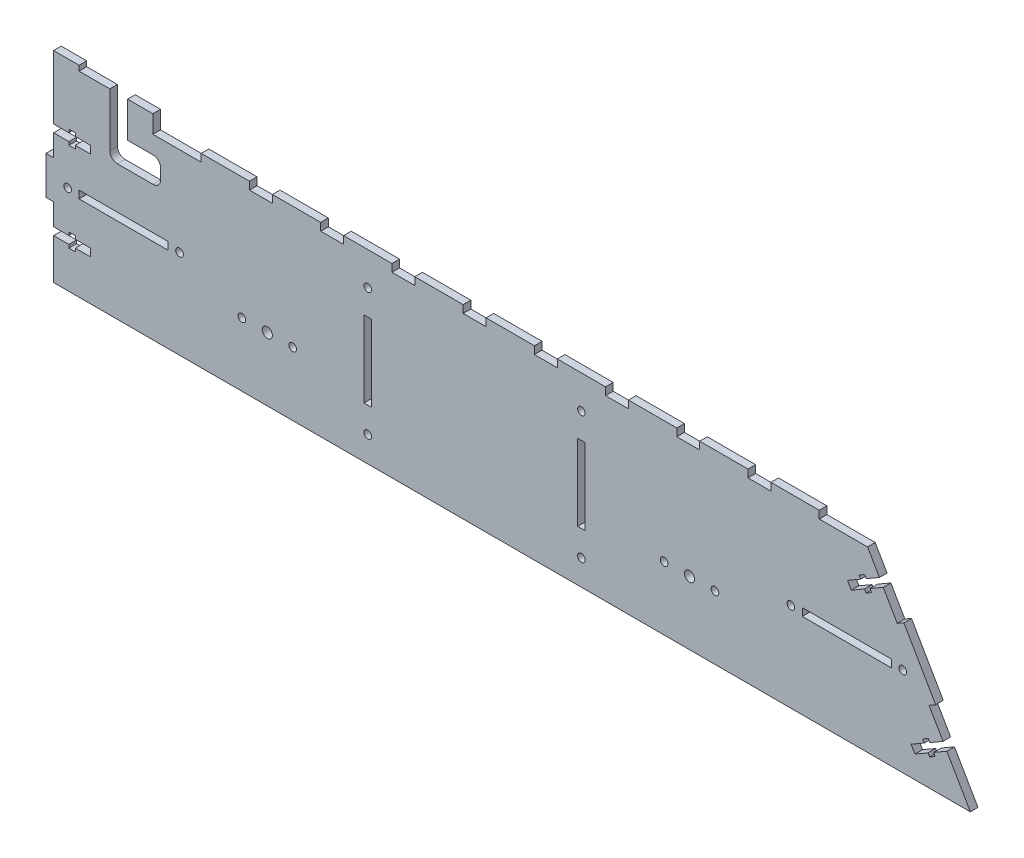
from build123d import *

# Parameters (mm, degrees)
SKETCH_1_R             = 2
SKETCH_1_R_2           = 1.5
EXTRUDE_1_DEPTH        = 3
SKETCH_2_W             = 19
SKETCH_2_H             = 3
EXTRUDE_2_DEPTH        = 3
PATTERN_LINEAR_1_COUNT = 9
PATTERN_LINEAR_1_PITCH = 28
SKETCH_3_W             = 3
SKETCH_3_H             = 30
CUT_EXTRUDE_1_DEPTH    = 3
SKETCH_4_W             = 35
SKETCH_4_H             = 3
CUT_EXTRUDE_2_DEPTH    = 3
SKETCH_5_R             = 1.5
CUT_EXTRUDE_3_DEPTH    = 3
CUT_EXTRUDE_4_DEPTH    = 3
CUT_EXTRUDE_5_DEPTH    = 3
SKETCH_8_W             = 39
SKETCH_8_H             = 3
EXTRUDE_3_DEPTH        = 9
SKETCH_9_W             = 29
SKETCH_9_H             = 3
CUT_EXTRUDE_6_DEPTH    = 2
SKETCH_11_W            = 3
SKETCH_11_H            = 25
EXTRUDE_5_DEPTH        = 3
SKETCH_12_W            = 3
SKETCH_12_H            = 15
EXTRUDE_6_DEPTH        = 3
CUT_EXTRUDE_7_DEPTH    = 3
FILLET_1_R             = 3


with BuildPart() as part:
    # Эскиз1 → Бобышка-Вытянуть1 (new body)
    with BuildSketch(Plane.XY):
        Polygon((320, 70), (360.414518843, 0), (0, 0), (0, 70), align=None)
        with Locations((84, 25)):
            Circle(SKETCH_1_R, mode=Mode.SUBTRACT)
        with Locations((250, 25)):
            Circle(SKETCH_1_R, mode=Mode.SUBTRACT)
        with Locations((94, 25)):
            Circle(SKETCH_1_R_2, mode=Mode.SUBTRACT)
        with Locations((74, 25)):
            Circle(SKETCH_1_R_2, mode=Mode.SUBTRACT)
        with Locations((240, 25)):
            Circle(SKETCH_1_R_2, mode=Mode.SUBTRACT)
        with Locations((260, 25)):
            Circle(SKETCH_1_R_2, mode=Mode.SUBTRACT)
    extrude(amount=EXTRUDE_1_DEPTH)

    # Эскиз2 → Бобышка-Вытянуть2 (add)
    with BuildSketch(Plane(origin=(0, 70, 0), x_dir=(1, 0, 0), z_dir=(0, 1, 0))):
        with Locations((291.5, -1.5)):
            Rectangle(SKETCH_2_W, SKETCH_2_H)
    extrude_2 = extrude(amount=EXTRUDE_2_DEPTH)

    # Линейный массив1: Бобышка-Вытянуть2 ×9
    with Locations(*[(-i * PATTERN_LINEAR_1_PITCH, 0, 0) for i in range(1, PATTERN_LINEAR_1_COUNT)]):
        add(extrude_2)

    # Эскиз3 → Вырез-Вытянуть1 (cut)
    with BuildSketch(Plane.XY.offset(3)):
        with Locations((207.5, 35)):
            Rectangle(SKETCH_3_W, SKETCH_3_H)
        with Locations((123.5, 35)):
            Rectangle(SKETCH_3_W, SKETCH_3_H)
    extrude(amount=-CUT_EXTRUDE_1_DEPTH, mode=Mode.SUBTRACT)

    # Эскиз4 → Вырез-Вытянуть2 (cut)
    with BuildSketch(Plane.XY.offset(3)):
        with Locations((311.841234018, 35)):
            Rectangle(SKETCH_4_W, SKETCH_4_H)
        with Locations((27.5, 35)):
            Rectangle(SKETCH_4_W, SKETCH_4_H)
    extrude(amount=-CUT_EXTRUDE_2_DEPTH, mode=Mode.SUBTRACT)

    # Эскиз5 → Вырез-Вытянуть3 (cut)
    with BuildSketch(Plane.XY.offset(3)):
        with Locations((5.5, 35)):
            Circle(SKETCH_5_R)
        with Locations((49.5, 35)):
            Circle(SKETCH_5_R)
        with Locations((123.5, 60)):
            Circle(SKETCH_5_R)
        with Locations((123.5, 10)):
            Circle(SKETCH_5_R)
        with Locations((207.5, 60)):
            Circle(SKETCH_5_R)
        with Locations((207.5, 10)):
            Circle(SKETCH_5_R)
        with Locations((289.841234018, 35)):
            Circle(SKETCH_5_R)
        with Locations((333.841234018, 35)):
            Circle(SKETCH_5_R)
    extrude(amount=-CUT_EXTRUDE_3_DEPTH, mode=Mode.SUBTRACT)

    # Эскиз6 → Вырез-Вытянуть4 (cut)
    with BuildSketch(Plane.XY.offset(3)):
        Polygon((0, 54), (6, 54), (6, 55.25), (8.5, 55.25), (8.5, 54), (14.5, 54), (14.5, 51), (8.5, 51), (8.5, 49.75), (6, 49.75), (6, 51), (0, 51), align=None)
        Polygon((0, 19), (6, 19), (6, 20.25), (8.5, 20.25), (8.5, 19), (14.5, 19), (14.5, 16), (8.5, 16), (8.5, 14.75), (6, 14.75), (6, 16), (0, 16), align=None)
    extrude(amount=-CUT_EXTRUDE_4_DEPTH, mode=Mode.SUBTRACT)

    # Эскиз7 → Вырез-Вытянуть5 (cut)
    with BuildSketch(Plane.XY.offset(3)):
        Polygon((324.664518843, 61.920816371), (319.468366421, 58.920816371), (318.843366421, 60.003348125), (316.678302911, 58.753348125), (317.303302911, 57.670816371), (312.107150488, 54.670816371), (313.607150488, 52.072740159), (318.803302911, 55.072740159), (319.428302911, 53.990208405), (321.593366421, 55.240208405), (320.968366421, 56.322740159), (326.164518843, 59.322740159), align=None)
        Polygon((349.664518843, 18.619546181), (344.468366421, 15.619546181), (343.843366421, 16.702077936), (341.678302911, 15.452077936), (342.303302911, 14.369546181), (337.107150488, 11.369546181), (338.607150488, 8.77146997), (343.803302911, 11.77146997), (344.428302911, 10.688938215), (346.593366421, 11.938938215), (345.968366421, 13.02146997), (351.164518843, 16.02146997), align=None)
    extrude(amount=-CUT_EXTRUDE_5_DEPTH, mode=Mode.SUBTRACT)

    # Эскиз8 → Бобышка-Вытянуть3 (add)
    with BuildSketch(Plane(origin=(0, 70, 0), x_dir=(1, 0, 0), z_dir=(0, 1, 0))):
        with Locations((19.5, -1.5)):
            Rectangle(SKETCH_8_W, SKETCH_8_H)
    extrude(amount=EXTRUDE_3_DEPTH)

    # Эскиз9 → Вырез-Вытянуть6 (cut)
    with BuildSketch(Plane(origin=(0, 79, 0), x_dir=(1, 0, 0), z_dir=(0, 1, 0))):
        with Locations((24.5, -1.5)):
            Rectangle(SKETCH_9_W, SKETCH_9_H)
    extrude(amount=-CUT_EXTRUDE_6_DEPTH, mode=Mode.SUBTRACT)

    # Эскиз11 → Бобышка-Вытянуть5 (add)
    with BuildSketch(Plane(origin=(270.310889132, 156.064064606, 0), x_dir=(0, 0, -1), z_dir=(0.8660254037844416, 0.4999999999999949, 0))):
        with Locations((-1.5, -135.207259422)):
            Rectangle(SKETCH_11_W, SKETCH_11_H)
    extrude(amount=EXTRUDE_5_DEPTH)

    # Эскиз12 → Бобышка-Вытянуть6 (add)
    with BuildSketch(Plane.ZY):
        with Locations((1.5, 35)):
            Rectangle(SKETCH_12_W, SKETCH_12_H)
    extrude(amount=EXTRUDE_6_DEPTH)

    # Эскиз13 → Вырез-Вытянуть7 (cut)
    with BuildSketch(Plane.XY.offset(3)):
        Polygon((22.07564967, 62.99517076), (22.07564967, 77), (29.07564967, 77), (29.07564967, 62.99517076), (42.07564967, 62.99517076), (42.07564967, 52.99517076), (22.07564967, 52.99517076), align=None)
    extrude(amount=-CUT_EXTRUDE_7_DEPTH, mode=Mode.SUBTRACT)

    # Скругление1
    fillet_1_edges = [part.edges().sort_by_distance(p)[0] for p in [
        (22.07564967, 52.99517076, 1.5),
        (42.07564967, 62.99517076, 1.5),
        (42.07564967, 52.99517076, 1.5),
    ]]
    fillet(fillet_1_edges, radius=FILLET_1_R)


solid = part.part
